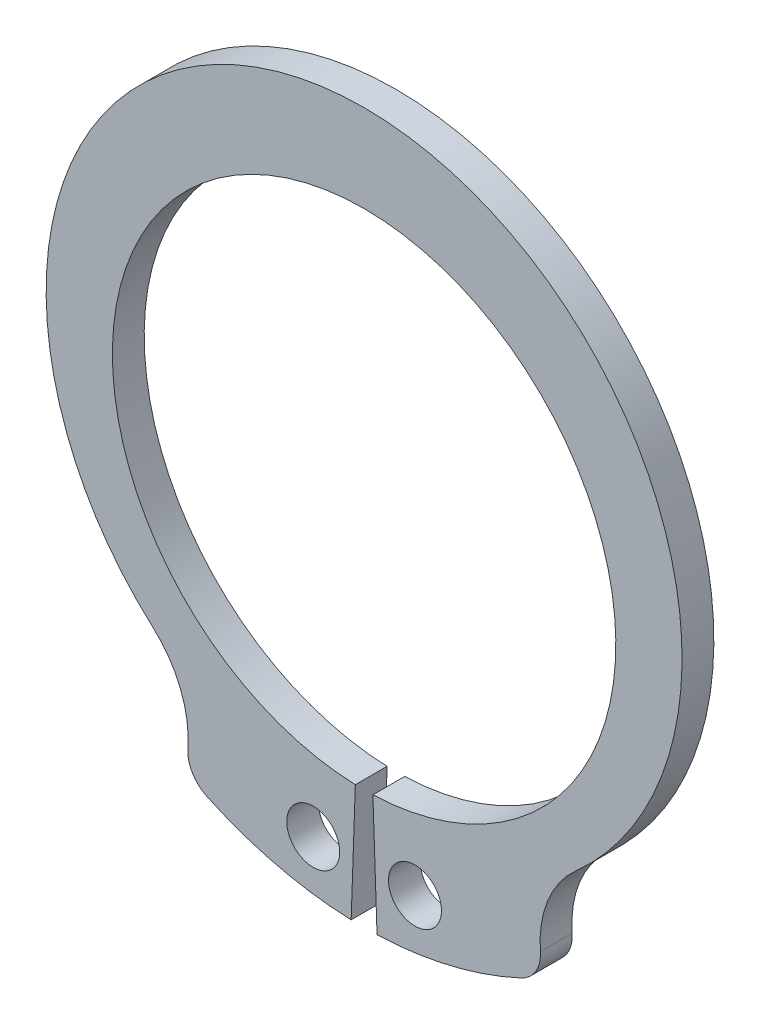
from build123d import *

# Parameters (mm, degrees)
SKETCH3_R           = 1
BOSS_EXTRUDE1_DEPTH = 1.2


with BuildPart() as part:
    # Sketch3 → Boss-Extrude1 (new body)
    with BuildSketch(Plane.XY):
        with BuildLine():
            Line((0.331545219, -9.494212857), (0.488592954, -13.991471578))
            ThreePointArc((0.488592954, -13.991471578), (3.278779951, -13.610642969), (5.936307279, -12.67912678))
            ThreePointArc((5.936307279, -12.67912678), (6.485759761, -12.177318472), (6.652672524, -11.452163497))
            ThreePointArc((6.652672524, -11.452163497), (6.931847444, -9.65141373), (7.980846189, -8.161366754))
            ThreePointArc((7.980846189, -8.161366754), (5.5e-08, 12.8), (-7.980846271, -8.161366682))
            ThreePointArc((-7.980846271, -8.161366682), (-6.931847465, -9.65141368), (-6.652672524, -11.452163497))
            ThreePointArc((-6.652672524, -11.452163497), (-6.485759771, -12.177318454), (-5.936307315, -12.679126762))
            ThreePointArc((-5.936307315, -12.679126762), (-3.278779971, -13.610642964), (-0.488592954, -13.991471578))
            Line((-0.488592954, -13.991471578), (-0.331545219, -9.494212857))
            ThreePointArc((-0.331545219, -9.494212857), (0, 9.5), (0.331545219, -9.494212857))
        make_face()
        with Locations((-1.919665731, -11.991471578)):
            Circle(SKETCH3_R, mode=Mode.SUBTRACT)
        with Locations((1.919665731, -11.991471578)):
            Circle(SKETCH3_R, mode=Mode.SUBTRACT)
    extrude(amount=BOSS_EXTRUDE1_DEPTH)


solid = part.part
